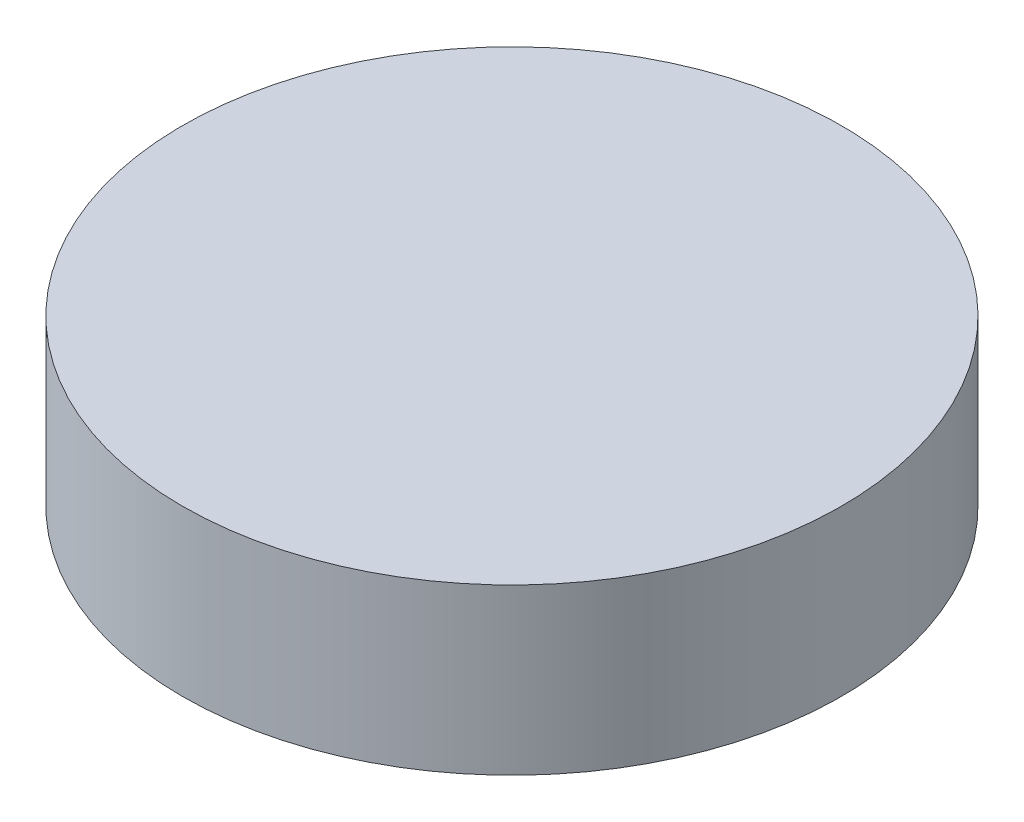
from build123d import *

# Parameters (mm, degrees)
SKETCH1_R           = 25.4
BOSS_EXTRUDE1_DEPTH = 12.7


with BuildPart() as part:
    # Sketch1 → Boss-Extrude1 (new body)
    with BuildSketch(Plane(origin=(0, 0, 0), x_dir=(1, 0, 0), z_dir=(0, 1, 0))):
        Circle(SKETCH1_R)
    extrude(amount=BOSS_EXTRUDE1_DEPTH)


solid = part.part
